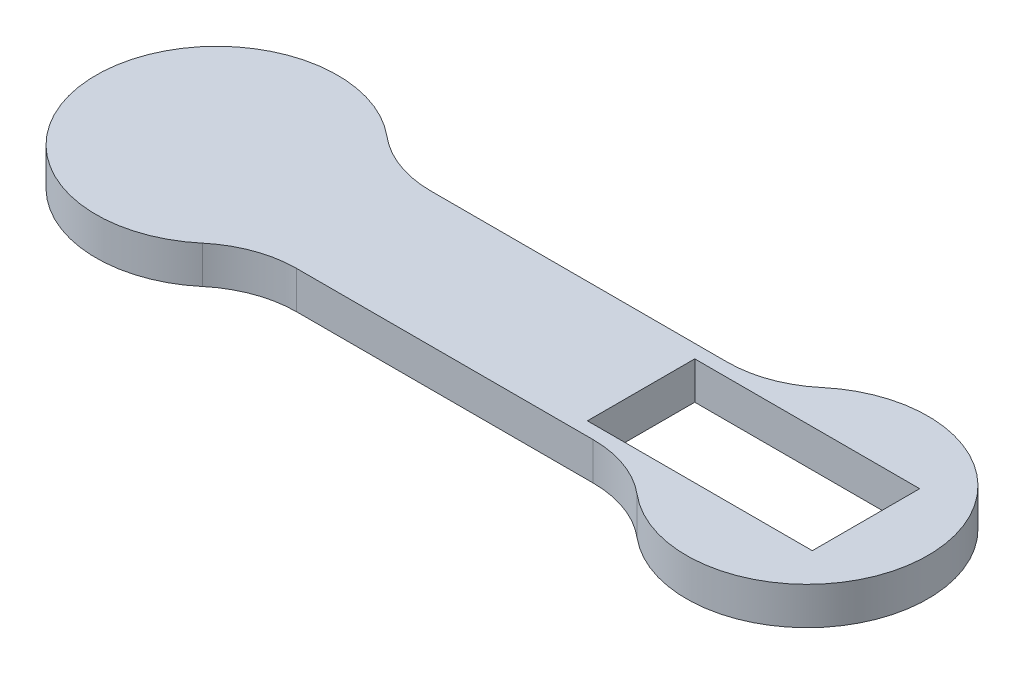
from build123d import *

# Parameters (mm, degrees)
BOSS_EXTRUDE1_DEPTH = 7
SKETCH3_W           = 41.9
SKETCH3_H           = 20
CUT_EXTRUDE1_DEPTH  = 135.578973098


with BuildPart() as part:
    # Sketch2 → Boss-Extrude1 (new body)
    with BuildSketch(Plane(origin=(0, 0, 0), x_dir=(1, 0, 0), z_dir=(0, 1, 0))):
        with BuildLine():
            Line((27.386127875, 12.5), (82.613872125, 12.5))
            ThreePointArc((82.613872125, 12.5), (89.47381553, 13.713271267), (95.501461713, 17.205882353))
            ThreePointArc((95.501461713, 17.205882353), (132.5, 0), (95.501461713, -17.205882353))
            ThreePointArc((95.501461713, -17.205882353), (89.47381553, -13.713271267), (82.613872125, -12.5))
            Line((82.613872125, -12.5), (27.386127875, -12.5))
            ThreePointArc((27.386127875, -12.5), (20.52618447, -13.713271267), (14.498538287, -17.205882353))
            ThreePointArc((14.498538287, -17.205882353), (-22.5, 0), (14.498538287, 17.205882353))
            ThreePointArc((14.498538287, 17.205882353), (20.52618447, 13.713271267), (27.386127875, 12.5))
        make_face()
    extrude(amount=BOSS_EXTRUDE1_DEPTH)

    # Sketch3 → Cut-Extrude1 (cut, through all)
    with BuildSketch(Plane(origin=(0, 7, 0), x_dir=(1, 0, 0), z_dir=(0, 1, 0))):
        with Locations((100, 0)):
            Rectangle(SKETCH3_W, SKETCH3_H)
    extrude(amount=-CUT_EXTRUDE1_DEPTH, mode=Mode.SUBTRACT)


solid = part.part
